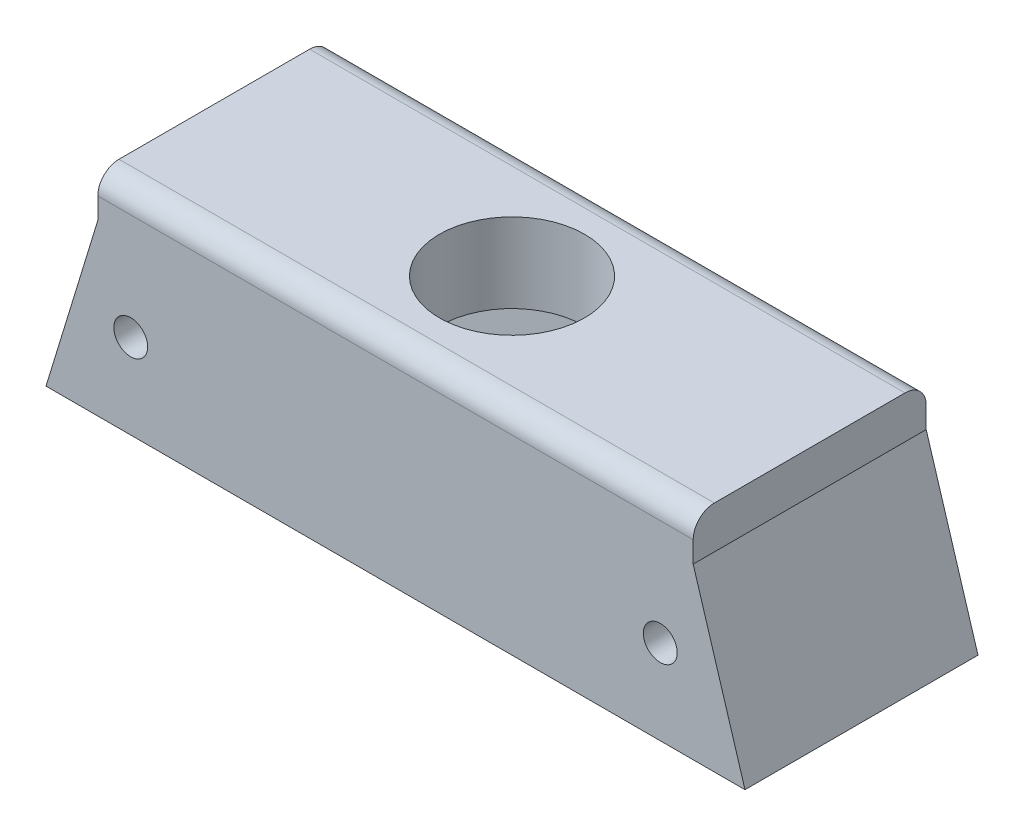
from build123d import *

# Parameters (mm, degrees)
SKETCH1_W                      = 33
SKETCH1_H                      = 11
SKETCH1_W_2                    = 30
SKETCH1_H_2                    = 8
BOSS_EXTRUDE1_DEPTH            = 8
SKETCH3_R                      = 0.8
CUT_EXTRUDE3_DEPTH             = 22.38340478
CUT_EXTRUDE5_REACH             = 21.144
SKETCH5_R                      = 3.425
CUT_EXTRUDE5_DIRECTION_2_DEPTH = 20.144189719
CUT_EXTRUDE4_DEPTH             = 22.38340478
CUT_EXTRUDE9_START             = -1.5
CUT_EXTRUDE9_DEPTH             = 8
SKETCH9_W                      = 22
SKETCH9_H                      = 8
CUT_EXTRUDE8_DEPTH             = 2.25
BOSS_EXTRUDE8_START            = 2
SKETCH12_W                     = 28.108309096
SKETCH12_H                     = 11
SKETCH12_R                     = 3.425
BOSS_EXTRUDE8_DEPTH            = 2
FILLET1_R                      = 1
CHAMFER1_SIZE                  = 1.5
CHAMFER1_SIZE_2                = 3.369055161
CHAMFER2_SIZE                  = 0.5
CHAMFER2_SIZE2                 = 1.123018387
CHAMFER3_SIZE                  = 0.5
CHAMFER3_SIZE2                 = 1.123018387


with BuildPart() as part:
    # Sketch1 → Boss-Extrude1 (new body)
    # profile 1 of 2: a face of its own
    with BuildSketch(Plane(origin=(0, 0, 0), x_dir=(1, 0, 0), z_dir=(0, 1, 0))):
        Rectangle(SKETCH1_W, SKETCH1_H)
        Rectangle(SKETCH1_W_2, SKETCH1_H_2, mode=Mode.SUBTRACT)
    # profile 2 of 2: a face of its own
    with BuildSketch(Plane(origin=(0, 0, 0), x_dir=(1, 0, 0), z_dir=(0, 1, 0))):
        Rectangle(SKETCH1_W_2, SKETCH1_H_2)
    extrude(amount=BOSS_EXTRUDE1_DEPTH)

    # Sketch3 → Cut-Extrude3 (cut, through all)
    with BuildSketch(Plane.XY.offset(5.5)):
        with Locations((-12.5, 4)):
            Circle(SKETCH3_R)
        with Locations((12.5, 4)):
            Circle(SKETCH3_R)
    extrude(amount=-CUT_EXTRUDE3_DEPTH, mode=Mode.SUBTRACT)

    # Sketch5 → Cut-Extrude5 (cut, up to next)
    with BuildSketch(Plane(origin=(0, 8, 0), x_dir=(1, 0, 0), z_dir=(0, 1, 0)), mode=Mode.PRIVATE) as cut_extrude5_sk1:
        with Locations(Location((0, 0, 0), (0, 0, 90))):
            Circle(SKETCH5_R)
    cut_extrude5_tool1 = extrude(cut_extrude5_sk1.sketch, amount=-CUT_EXTRUDE5_REACH, mode=Mode.PRIVATE) & part.part
    add(cut_extrude5_tool1.solids().sort_by_distance((0, 8, 0))[0], mode=Mode.SUBTRACT)

    # Sketch5 → Cut-Extrude5 direction 2 (cut)
    with BuildSketch(Plane(origin=(0, 8, 0), x_dir=(1, 0, 0), z_dir=(0, 1, 0))):
        with Locations(Location((0, 0, 0), (0, 0, 90))):
            Circle(SKETCH5_R)
    extrude(amount=CUT_EXTRUDE5_DIRECTION_2_DEPTH, mode=Mode.SUBTRACT)

    # Sketch4 → Cut-Extrude4 (cut, through all)
    with BuildSketch(Plane.XY.offset(5.5)):
        Polygon((-16.5, 0), (-14.054154548, 8), (-16.5, 8), align=None)
        Polygon((16.5, 0), (14.054154548, 8), (16.5, 8), align=None)
    extrude(amount=-CUT_EXTRUDE4_DEPTH, mode=Mode.SUBTRACT)

    # Sketch14 → Cut-Extrude9 (cut)
    with BuildSketch(Plane.XY.offset(5.5).offset(CUT_EXTRUDE9_START)):
        Polygon((-15, 0), (15, 0), (14.235673296, 2.5), (-14.235673296, 2.5), align=None)
    extrude(amount=-CUT_EXTRUDE9_DEPTH, mode=Mode.SUBTRACT)

    # Sketch9 → Cut-Extrude8 (cut)
    with BuildSketch(Plane.XZ.offset(-2.5)):
        Rectangle(SKETCH9_W, SKETCH9_H)
    extrude(amount=-CUT_EXTRUDE8_DEPTH, mode=Mode.SUBTRACT)

    # Sketch12 → Boss-Extrude8 (add)
    with BuildSketch(Plane(origin=(0, 8, 0), x_dir=(1, 0, 0), z_dir=(0, 1, 0)).offset(BOSS_EXTRUDE8_START)):
        Rectangle(SKETCH12_W, SKETCH12_H)
        with Locations(Location((0, 0, 0), (0, 0, 90))):
            Circle(SKETCH12_R, mode=Mode.SUBTRACT)
    extrude(amount=-BOSS_EXTRUDE8_DEPTH)

    # Fillet1
    fillet1_edges = [part.edges().sort_by_distance(p)[0] for p in [
        (0, 10, 5.5),
        (0, 10, -5.5),
    ]]
    fillet(fillet1_edges, radius=FILLET1_R)

    # Chamfer1
    # the kernel refuses this chamfer: 3.369055161, 1.5 mm, written as the material it takes off along each edge
    with BuildSketch(Plane(origin=(0, 4.75, 0), x_dir=(0, 0, -1), z_dir=(1, 0, 0))) as chamfer1_piece_1_section:
        Polygon((3.425, CHAMFER1_SIZE), (3.425 + CHAMFER1_SIZE_2, 0), (3.425, 0), align=None)
    chamfer1_piece_1 = revolve(axis=Axis((0, 4.75, 0), (0, 1, 0)), mode=Mode.PRIVATE)
    chamfer1_piece_1 = split(chamfer1_piece_1, bisect_by=Plane(origin=(-3.367570152, 6.000830153, 4), z_dir=(0, 0, -1)), keep=Keep.TOP, mode=Mode.PRIVATE)
    chamfer1_piece_1 = split(chamfer1_piece_1, bisect_by=Plane(origin=(-3.367570152, 6.000830153, -4), z_dir=(0, 0, 1)), keep=Keep.TOP, mode=Mode.PRIVATE)
    add(chamfer1_piece_1, mode=Mode.SUBTRACT)

    # Chamfer2
    chamfer2_edges = [part.edges().sort_by_distance(p)[0] for p in [
        (-11, 2.5, 0),
    ]]
    chamfer2_side = [part.faces().sort_by_distance(p)[0] for p in [
        (-11, 3.625, 0),
    ]]
    chamfer(chamfer2_edges, length=CHAMFER2_SIZE, length2=CHAMFER2_SIZE2, reference=chamfer2_side[0])

    # Chamfer3
    chamfer3_edges = [part.edges().sort_by_distance(p)[0] for p in [
        (11, 2.5, 0),
    ]]
    chamfer3_side = [part.faces().sort_by_distance(p)[0] for p in [
        (11, 3.625, 0),
    ]]
    chamfer(chamfer3_edges, length=CHAMFER3_SIZE, length2=CHAMFER3_SIZE2, reference=chamfer3_side[0])


solid = part.part
